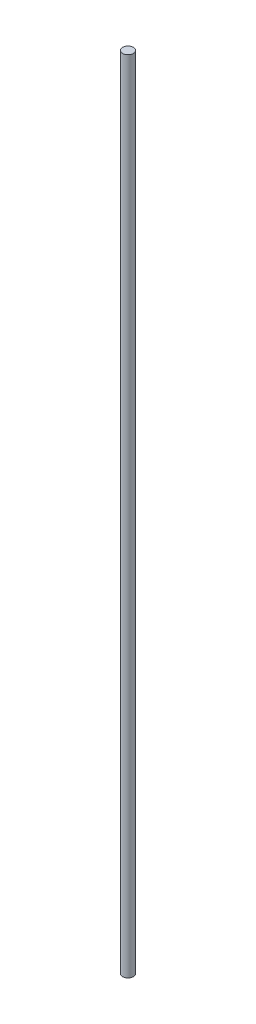
from build123d import *

# Parameters (mm, degrees)
SKETCH1_R           = 2
BOSS_EXTRUDE1_DEPTH = 299


with BuildPart() as part:
    # Sketch1 → Boss-Extrude1 (new body)
    with BuildSketch(Plane(origin=(0, 0, 0), x_dir=(1, 0, 0), z_dir=(0, 1, 0))):
        Circle(SKETCH1_R)
    extrude(amount=BOSS_EXTRUDE1_DEPTH)


solid = part.part
